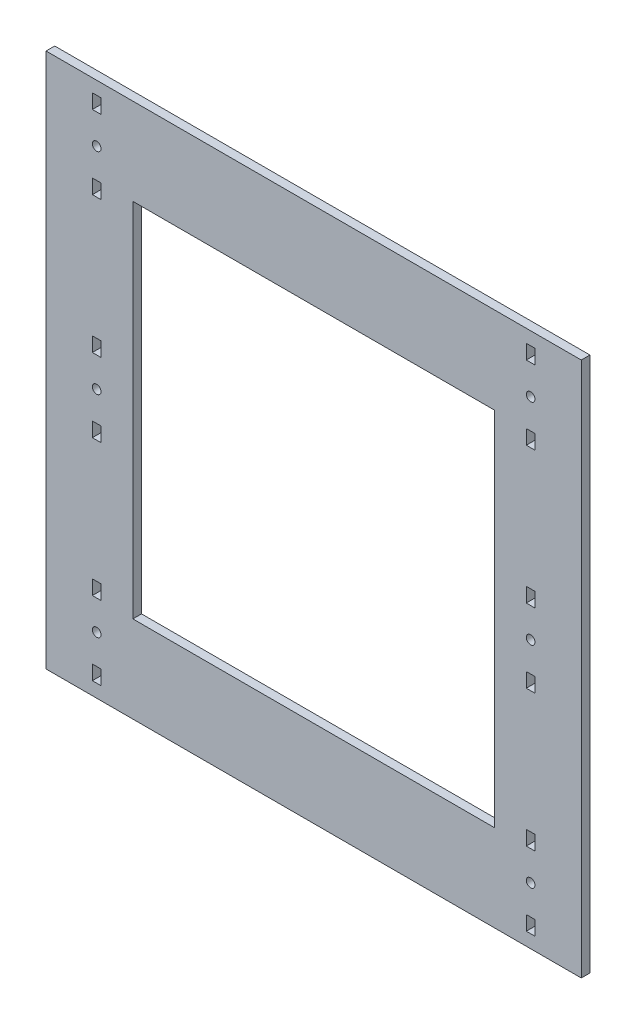
from build123d import *

# Parameters (mm, degrees)
SKETCH1_W           = 370
SKETCH1_H           = 370
SKETCH1_R           = 3
SKETCH1_W_2         = 250
SKETCH1_H_2         = 250
SKETCH1_W_3         = 6
SKETCH1_H_3         = 10
BOSS_EXTRUDE1_DEPTH = 3


with BuildPart() as part:
    # Sketch1 → Boss-Extrude1 (new, symmetric)
    with BuildSketch(Plane.XY):
        Rectangle(SKETCH1_W, SKETCH1_H)
        with Locations((-150, 145.5)):
            Circle(SKETCH1_R, mode=Mode.SUBTRACT)
        with Locations((-150, 0)):
            Circle(SKETCH1_R, mode=Mode.SUBTRACT)
        with Locations((-150, -145.5)):
            Circle(SKETCH1_R, mode=Mode.SUBTRACT)
        with Locations((150, -145.5)):
            Circle(SKETCH1_R, mode=Mode.SUBTRACT)
        with Locations((150, 0)):
            Circle(SKETCH1_R, mode=Mode.SUBTRACT)
        with Locations((150, 145.5)):
            Circle(SKETCH1_R, mode=Mode.SUBTRACT)
        Rectangle(SKETCH1_W_2, SKETCH1_H_2, mode=Mode.SUBTRACT)
        with Locations((-150, 171)):
            Rectangle(SKETCH1_W_3, SKETCH1_H_3, mode=Mode.SUBTRACT)
        with Locations((-150, 120)):
            Rectangle(SKETCH1_W_3, SKETCH1_H_3, mode=Mode.SUBTRACT)
        with Locations((-150, 25.5)):
            Rectangle(SKETCH1_W_3, SKETCH1_H_3, mode=Mode.SUBTRACT)
        with Locations((-150, -25.5)):
            Rectangle(SKETCH1_W_3, SKETCH1_H_3, mode=Mode.SUBTRACT)
        with Locations((-150, -120)):
            Rectangle(SKETCH1_W_3, SKETCH1_H_3, mode=Mode.SUBTRACT)
        with Locations((-150, -171)):
            Rectangle(SKETCH1_W_3, SKETCH1_H_3, mode=Mode.SUBTRACT)
        with Locations((150, -171)):
            Rectangle(SKETCH1_W_3, SKETCH1_H_3, mode=Mode.SUBTRACT)
        with Locations((150, -120)):
            Rectangle(SKETCH1_W_3, SKETCH1_H_3, mode=Mode.SUBTRACT)
        with Locations((150, -25.5)):
            Rectangle(SKETCH1_W_3, SKETCH1_H_3, mode=Mode.SUBTRACT)
        with Locations((150, 25.5)):
            Rectangle(SKETCH1_W_3, SKETCH1_H_3, mode=Mode.SUBTRACT)
        with Locations((150, 120)):
            Rectangle(SKETCH1_W_3, SKETCH1_H_3, mode=Mode.SUBTRACT)
        with Locations((150, 171)):
            Rectangle(SKETCH1_W_3, SKETCH1_H_3, mode=Mode.SUBTRACT)
    extrude(amount=BOSS_EXTRUDE1_DEPTH, both=True)


solid = part.part
